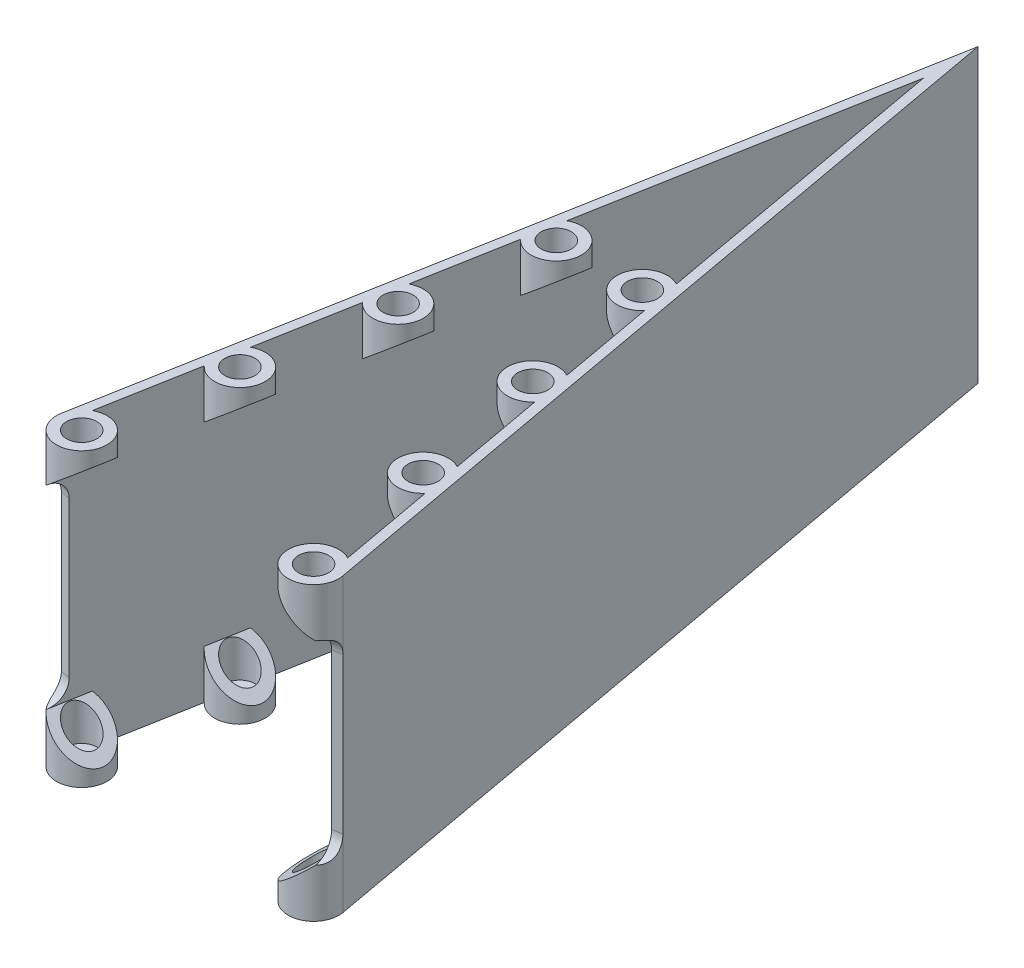
from build123d import *

# Parameters (mm, degrees)
BOSS_EXTRUDE1_DEPTH            = 30
SKETCH2_R                      = 2.6
SKETCH2_R_2                    = 1.55
BOSS_EXTRUDE3_DEPTH            = 5
CUT_EXTRUDE1_REACH             = 90.931
CUT_EXTRUDE1_DIRECTION_2_DEPTH = 89.931178746
CUT_EXTRUDE2_REACH             = 90.931
CUT_EXTRUDE2_DIRECTION_2_DEPTH = 89.931178746
FILLET1_R                      = 2
SKETCH6_R                      = 2.6
BOSS_EXTRUDE4_DEPTH            = 1


with BuildPart() as part:
    # Sketch1 → Boss-Extrude1 (new body)
    with BuildSketch(Plane(origin=(0, 0, 0), x_dir=(1, 0, 0), z_dir=(0, 1, 0))):
        Polygon((-13.5, 0), (0, 74.39897269), (13.5, 0), (14.483932895, 0.178538676), (0, 80), (-14.483932895, 0.178538676), align=None)
    extrude(amount=BOSS_EXTRUDE1_DEPTH)

    # Sketch2 → Boss-Extrude3 (add)
    # profile 1 of 8: a face of its own
    with BuildSketch(Plane(origin=(0, 0, 0), x_dir=(1, 0, 0), z_dir=(0, 1, 0))):
        with Locations((11.925707369, -0.285661882)):
            Circle(SKETCH2_R)
        with Locations(Location((11.925707369, -0.285661882, 0), (0, 0, 270))):
            Circle(SKETCH2_R_2, mode=Mode.SUBTRACT)
    # profile 2 of 8: a face of its own
    with BuildSketch(Plane(origin=(0, 0, 0), x_dir=(1, 0, 0), z_dir=(0, 1, 0))):
        with Locations((9.426165905, 13.489398644)):
            Circle(SKETCH2_R)
        with Locations(Location((9.426165905, 13.489398644, 0), (0, 0, 270))):
            Circle(SKETCH2_R_2, mode=Mode.SUBTRACT)
    # profile 3 of 8: a face of its own
    with BuildSketch(Plane(origin=(0, 0, 0), x_dir=(1, 0, 0), z_dir=(0, 1, 0))):
        with Locations((6.926624441, 27.264459169)):
            Circle(SKETCH2_R)
        with Locations(Location((6.926624441, 27.264459169, 0), (0, 0, 270))):
            Circle(SKETCH2_R_2, mode=Mode.SUBTRACT)
    # profile 4 of 8: a face of its own
    with BuildSketch(Plane(origin=(0, 0, 0), x_dir=(1, 0, 0), z_dir=(0, 1, 0))):
        with Locations((4.427082978, 41.039519694)):
            Circle(SKETCH2_R)
        with Locations(Location((4.427082978, 41.039519694, 0), (0, 0, 270))):
            Circle(SKETCH2_R_2, mode=Mode.SUBTRACT)
    # profile 5 of 8: a face of its own
    with BuildSketch(Plane(origin=(0, 0, 0), x_dir=(1, 0, 0), z_dir=(0, 1, 0))):
        with Locations((-11.925707369, -0.285661882)):
            Circle(SKETCH2_R)
        with Locations(Location((-11.925707369, -0.285661882, 0), (0, 0, 90))):
            Circle(SKETCH2_R_2, mode=Mode.SUBTRACT)
    # profile 6 of 8: a face of its own
    with BuildSketch(Plane(origin=(0, 0, 0), x_dir=(1, 0, 0), z_dir=(0, 1, 0))):
        with Locations((-9.426165905, 13.489398644)):
            Circle(SKETCH2_R)
        with Locations(Location((-9.426165905, 13.489398644, 0), (0, 0, 90))):
            Circle(SKETCH2_R_2, mode=Mode.SUBTRACT)
    # profile 7 of 8: a face of its own
    with BuildSketch(Plane(origin=(0, 0, 0), x_dir=(1, 0, 0), z_dir=(0, 1, 0))):
        with Locations((-6.926624441, 27.264459169)):
            Circle(SKETCH2_R)
        with Locations(Location((-6.926624441, 27.264459169, 0), (0, 0, 90))):
            Circle(SKETCH2_R_2, mode=Mode.SUBTRACT)
    # profile 8 of 8: a face of its own
    with BuildSketch(Plane(origin=(0, 0, 0), x_dir=(1, 0, 0), z_dir=(0, 1, 0))):
        with Locations((-4.427082978, 41.039519694)):
            Circle(SKETCH2_R)
        with Locations(Location((-4.427082978, 41.039519694, 0), (0, 0, 90))):
            Circle(SKETCH2_R_2, mode=Mode.SUBTRACT)
    boss_extrude3 = extrude(amount=BOSS_EXTRUDE3_DEPTH)

    # Cut-Extrude1: up to this face of the body (flat: up to its plane)
    cut_extrude1_end = Plane(part.part.faces().sort_by_distance((-6.670361164, 15.408163761, -37.638378758))[0])
    # Sketch4 → Cut-Extrude1 (cut, up to the picked face)
    with BuildSketch(Plane(origin=(0.430326794, 0, 2.371546029), x_dir=(0.9839328946538309, 0, -0.17853867597283662), z_dir=(0.17853867597283662, 0, 0.9839328946538309)), mode=Mode.PRIVATE) as cut_extrude1_sk1:
        Polygon((13.283094078, 5), (9.083094078, 5), (9.083094078, 1.475781549), align=None)
    cut_extrude1_tool1 = split(extrude(cut_extrude1_sk1.sketch, amount=-CUT_EXTRUDE1_REACH, mode=Mode.PRIVATE), bisect_by=cut_extrude1_end, keep=Keep.BOTH, mode=Mode.PRIVATE)
    cut_extrude1 = cut_extrude1_tool1.solids().sort_by(Axis((10.744988, 3.825261, 0.499908), (-0.17853867597283662, 0, -0.9839328946538309)))[0]
    add(cut_extrude1, mode=Mode.SUBTRACT)

    # Sketch4 → Cut-Extrude1 direction 2 (cut)
    with BuildSketch(Plane(origin=(0.430326794, 0, 2.371546029), x_dir=(0.9839328946538309, 0, -0.17853867597283662), z_dir=(0.17853867597283662, 0, 0.9839328946538309))):
        Polygon((13.283094078, 5), (9.083094078, 5), (9.083094078, 1.475781549), align=None)
    cut_extrude1_direction_2 = extrude(amount=CUT_EXTRUDE1_DIRECTION_2_DEPTH, mode=Mode.SUBTRACT)

    # Cut-Extrude2: up to this face of the body (flat: up to its plane)
    cut_extrude2_end = Plane(part.part.faces().sort_by_distance((6.670361164, 15.408163761, -37.638378758))[0])
    # Sketch5 → Cut-Extrude2 (cut, up to the picked face)
    with BuildSketch(Plane(origin=(-0.430326794, 0, 2.371546029), x_dir=(0.9839328946538308, 0, 0.17853867597283732), z_dir=(-0.17853867597283732, 0, 0.9839328946538308)), mode=Mode.PRIVATE) as cut_extrude2_sk1:
        Polygon((-9.083094078, 5), (-9.083094078, 1.475781549), (-13.283094078, 5), align=None)
    cut_extrude2_tool1 = split(extrude(cut_extrude2_sk1.sketch, amount=-CUT_EXTRUDE2_REACH, mode=Mode.PRIVATE), bisect_by=cut_extrude2_end, keep=Keep.BOTH, mode=Mode.PRIVATE)
    cut_extrude2 = cut_extrude2_tool1.solids().sort_by(Axis((-10.744988, 3.825261, 0.499908), (0.17853867597283732, 0, -0.9839328946538308)))[0]
    add(cut_extrude2, mode=Mode.SUBTRACT)

    # Sketch5 → Cut-Extrude2 direction 2 (cut)
    with BuildSketch(Plane(origin=(-0.430326794, 0, 2.371546029), x_dir=(0.9839328946538308, 0, 0.17853867597283732), z_dir=(-0.17853867597283732, 0, 0.9839328946538308))):
        Polygon((-9.083094078, 5), (-9.083094078, 1.475781549), (-13.283094078, 5), align=None)
    cut_extrude2_direction_2 = extrude(amount=CUT_EXTRUDE2_DIRECTION_2_DEPTH, mode=Mode.SUBTRACT)

    # Mirror2: Boss-Extrude3, Cut-Extrude1, Cut-Extrude1 direction 2, Cut-Extrude2, Cut-Extrude2 direction 2 across plane
    add(boss_extrude3.mirror(Plane.ZX.offset(15)))
    add(cut_extrude1.mirror(Plane.ZX.offset(15)), mode=Mode.SUBTRACT)
    add(cut_extrude1_direction_2.mirror(Plane.ZX.offset(15)), mode=Mode.SUBTRACT)
    add(cut_extrude2.mirror(Plane.ZX.offset(15)), mode=Mode.SUBTRACT)
    add(cut_extrude2_direction_2.mirror(Plane.ZX.offset(15)), mode=Mode.SUBTRACT)

    # Fillet1
    # the kernel refuses this fillet: 2 mm, written as the material it adds along each edge
    with BuildSketch(Plane(origin=(13.5, 5, 0), x_dir=(0, 1, 0), z_dir=(0.9839328946538308, 0, -0.17853867597283668))) as fillet1_piece_1_section:
        with BuildLine():
            CenterArc((FILLET1_R, FILLET1_R), FILLET1_R, 180, 90)
            Line((0, FILLET1_R), (0, 0))
            Line((0, 0), (FILLET1_R, 0))
        make_face()
    fillet1_piece_1 = extrude(amount=6, mode=Mode.PRIVATE)
    fillet1_piece_1 = fillet1_piece_1 & Plane(origin=(11.925707369, 5.699977742, 0.285661882), x_dir=(1, 0, 0), z_dir=(0, -1, 0)) * Cylinder(2.6, 20, mode=Mode.PRIVATE)
    add(fillet1_piece_1)
    with BuildSketch(Plane(origin=(13.5, 25, 0), x_dir=(0, -1, 0), z_dir=(0.9839328946538308, 0, -0.17853867597283668))) as fillet1_piece_2_section:
        with BuildLine():
            CenterArc((FILLET1_R, -FILLET1_R), FILLET1_R, 90, 90)
            Line((0, -FILLET1_R), (0, 0))
            Line((0, 0), (FILLET1_R, 0))
        make_face()
    fillet1_piece_2 = extrude(amount=6, mode=Mode.PRIVATE)
    fillet1_piece_2 = fillet1_piece_2 & Plane(origin=(11.925707369, 24.300022258, 0.285661882), x_dir=(1, 0, 0), z_dir=(0, 1, 0)) * Cylinder(2.6, 20, mode=Mode.PRIVATE)
    add(fillet1_piece_2)
    with BuildSketch(Plane(origin=(-19.403597368, 25, -1.071232056), x_dir=(0, -1, 0), z_dir=(0.9839328946538307, 0, 0.17853867597283735))) as fillet1_piece_3_section:
        with BuildLine():
            CenterArc((FILLET1_R, -FILLET1_R), FILLET1_R, 90, 90)
            Line((0, -FILLET1_R), (0, 0))
            Line((0, 0), (FILLET1_R, 0))
        make_face()
    fillet1_piece_3 = extrude(amount=6, mode=Mode.PRIVATE)
    fillet1_piece_3 = fillet1_piece_3 & Plane(origin=(-11.925707369, 24.777637105, 0.285661882), x_dir=(1, 0, 0), z_dir=(0, 1, 0)) * Cylinder(2.6, 21, mode=Mode.PRIVATE)
    add(fillet1_piece_3)
    with BuildSketch(Plane(origin=(-19.403597368, 5, -1.071232056), x_dir=(-0.17853867597283735, 0, 0.9839328946538307), z_dir=(0.9839328946538307, 0, 0.17853867597283735))) as fillet1_piece_4_section:
        with BuildLine():
            CenterArc((FILLET1_R, -FILLET1_R), FILLET1_R, 90, 90)
            Line((0, -FILLET1_R), (0, 0))
            Line((0, 0), (FILLET1_R, 0))
        make_face()
    fillet1_piece_4 = extrude(amount=6, mode=Mode.PRIVATE)
    fillet1_piece_4 = fillet1_piece_4 & Plane(origin=(-11.925707369, 5.222362792, 0.285661882), x_dir=(1, 0, 0), z_dir=(0, -1, 0)) * Cylinder(2.6, 21, mode=Mode.PRIVATE)
    add(fillet1_piece_4)

    # Sketch6 → Boss-Extrude4 (add)
    with BuildSketch(Plane.XZ):
        with Locations((4.427082978, -41.039519694)):
            Circle(SKETCH6_R)
        with Locations((-4.427082978, -41.039519694)):
            Circle(SKETCH6_R)
        with Locations((-6.926624441, -27.264459169)):
            Circle(SKETCH6_R)
        with Locations((11.925707369, 0.285661882)):
            Circle(SKETCH6_R)
        with Locations((6.926624441, -27.264459169)):
            Circle(SKETCH6_R)
        with Locations((9.426165905, -13.489398644)):
            Circle(SKETCH6_R)
        with Locations((-9.426165905, -13.489398644)):
            Circle(SKETCH6_R)
        with Locations((-11.925707369, 0.285661882)):
            Circle(SKETCH6_R)
    extrude(amount=-BOSS_EXTRUDE4_DEPTH)


solid = part.part
